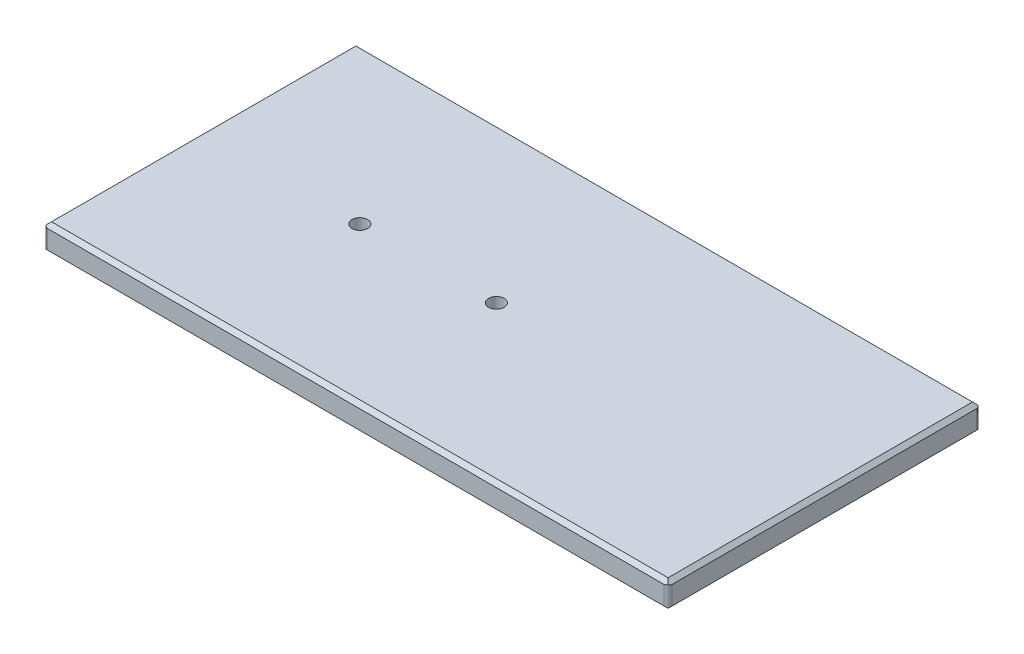
from build123d import *

# Parameters (mm, degrees)
SKETCH_1_W          = 160
SKETCH_1_H          = 80
EXTRUDE_1_DEPTH     = 6
CHAMFER_1_SIZE      = 1
CHAMFER_2_SIZE      = 0.2
SKETCH_3_R          = 2
CUT_EXTRUDE_2_DEPTH = 90.643739324
CHAMFER_4_SIZE      = 0.5
FILLET_1_R          = 1


with BuildPart() as part:
    # 草图1 → 凸台-拉伸1 (new body)
    with BuildSketch(Plane(origin=(0, 0, 0), x_dir=(1, 0, 0), z_dir=(0, 1, 0))):
        Rectangle(SKETCH_1_W, SKETCH_1_H)
    extrude(amount=EXTRUDE_1_DEPTH)

    # 倒角1
    chamfer_1_edges = [part.edges().sort_by_distance(p)[0] for p in [
        (80, 6, 0),
        (0, 6, -40),
        (-80, 6, 0),
        (0, 6, 40),
    ]]
    chamfer(chamfer_1_edges, length=CHAMFER_1_SIZE)

    # 倒角2
    chamfer_2_edges = [part.edges().sort_by_distance(p)[0] for p in [
        (0, 0, -40),
        (80, 0, 0),
        (0, 0, 40),
        (-80, 0, 0),
    ]]
    chamfer(chamfer_2_edges, length=CHAMFER_2_SIZE)

    # 草图3 → 切除-拉伸2 (cut, through all)
    with BuildSketch(Plane(origin=(0, 6, 0), x_dir=(1, 0, 0), z_dir=(0, 1, 0))):
        with Locations(Location((-39, 0, 0), (0, 0, 270))):
            Circle(SKETCH_3_R)
        with Locations(Location((-4, 0, 0), (0, 0, 270))):
            Circle(SKETCH_3_R)
    extrude(amount=-CUT_EXTRUDE_2_DEPTH, mode=Mode.SUBTRACT)

    # 倒角4
    chamfer_4_edges = [part.edges().sort_by_distance(p)[0] for p in [
        (-39, 0, -2),
        (-4, 0, -2),
    ]]
    chamfer(chamfer_4_edges, length=CHAMFER_4_SIZE)

    # 圆角1
    # the kernel refuses this fillet: 1 mm, written as the material it takes off along each edge
    with BuildSketch(Plane(origin=(-80, -2.3, -40), x_dir=(1, 0, 0), z_dir=(0, 1, 0)), Plane(origin=(-80, -2.3, 40), x_dir=(0, 0, -1), z_dir=(0, 1, 0))) as fillet_1_piece_1:
        with BuildLine():
            CenterArc((FILLET_1_R, -FILLET_1_R), FILLET_1_R, 90, 90)
            Line((0, -FILLET_1_R), (0, 0))
            Line((0, 0), (FILLET_1_R, 0))
        make_face()
    extrude(amount=9.8, mode=Mode.SUBTRACT)
    with BuildSketch(Plane(origin=(80, -2.3, -40), x_dir=(-1, 0, 0), z_dir=(0, 1, 0)), Plane(origin=(80, -2.3, 40), x_dir=(0, 0, -1), z_dir=(0, 1, 0))) as fillet_1_piece_2:
        with BuildLine():
            CenterArc((FILLET_1_R, FILLET_1_R), FILLET_1_R, 180, 90)
            Line((0, FILLET_1_R), (0, 0))
            Line((0, 0), (FILLET_1_R, 0))
        make_face()
    extrude(amount=9.8, mode=Mode.SUBTRACT)


solid = part.part
